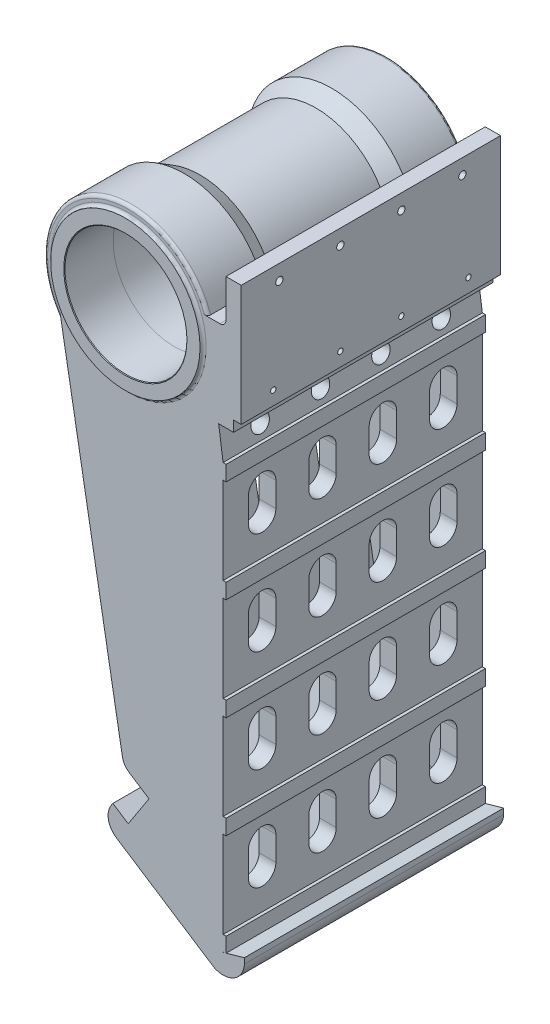
from build123d import *

# Parameters (mm, degrees)
SKETCH_1_R                      = 245
EXTRUDE_1_DEPTH                 = 190
SKETCH_2_R                      = 245
EXTRUDE_2_DEPTH                 = 52
EXTRUDE_2_DRAFT                 = -30
SKETCH_3_R                      = 275.022213998
EXTRUDE_3_DEPTH                 = 183
EXTRUDE_START                   = 10
SKETCH_4_R                      = 245
EXTRUDE_4_DEPTH                 = 10
FILLET_1_R                      = 10
FILLET_2_R                      = 10
SKETCH_5_R                      = 200
CUT_EXTRUDE_1_DEPTH             = 160
CHAMFER_1_SIZE                  = 2
MIRROR_3_COPY_1_SKETCH_R        = 245
MIRROR_3_COPY_1_DEPTH           = 52
MIRROR_3_COPY_1_DRAFT           = -30
FILLET_1_OF_MIRROR_3_R          = 10
FILLET_2_OF_MIRROR_3_R          = 10
CHAMFER_1_OF_MIRROR_3_SIZE      = 2
SKETCH_6_R                      = 200.25
CUT_EXTRUDE_2_DEPTH             = 550
EXTRUDE_5_DEPTH                 = 425
EXTRUDE_6_DEPTH                 = 425
EXTRUDE_8_DEPTH                 = 49
SKETCH_14_W                     = 10
SKETCH_14_H                     = 50
EXTRUDE_9_DEPTH                 = 425
PATTERN_LINEAR_1_COUNT          = 5
PATTERN_LINEAR_1_PITCH          = 335
FILLET_4_R                      = 20
FILLET_5_R                      = 50
FILLET_6_R                      = 60
SKETCH_15_R                     = 12
CUT_EXTRUDE_5_DEPTH             = 50
SKETCH_16_R                     = 17.5
CUT_EXTRUDE_6_DEPTH             = 5
PATTERN_LINEAR_3_COUNT          = 3
PATTERN_LINEAR_3_PITCH          = 200
PATTERN_LINEAR_3_COUNT_DIR2     = 3
PATTERN_LINEAR_3_PITCH_DIR2     = 200
CUT_EXTRUDE_7_REACH             = 1922.39
SKETCH_17_R                     = 30
PATTERN_LINEAR_7_COUNT          = 2
PATTERN_LINEAR_7_PITCH          = 198
PATTERN_LINEAR_7_COL_COUNT      = 3
PATTERN_LINEAR_7_COL_PITCH      = 198
PATTERN_LINEAR_8_COUNT          = 2
PATTERN_LINEAR_8_PITCH          = 200
PATTERN_LINEAR_8_COL_COUNT      = 2
PATTERN_LINEAR_8_COL_PITCH      = 220
CUT_EXTRUDE_8_DEPTH             = 55
PATTERN_LINEAR_9_COUNT          = 3
PATTERN_LINEAR_9_PITCH          = 198
PATTERN_LINEAR_9_COUNT_DIR2     = 3
PATTERN_LINEAR_9_PITCH_DIR2     = 198
PATTERN_LINEAR_10_COUNT         = 4
PATTERN_LINEAR_10_PITCH         = 335
PATTERN_LINEAR_10_COPY_1_DEPTH  = 55
PATTERN_LINEAR_10_COPY_2_DEPTH  = 55
PATTERN_LINEAR_10_COPY_3_DEPTH  = 55
PATTERN_LINEAR_10_COPY_4_DEPTH  = 55
PATTERN_LINEAR_10_COPY_5_DEPTH  = 55
PATTERN_LINEAR_10_COPY_6_DEPTH  = 55
PATTERN_LINEAR_10_COPY_7_DEPTH  = 55
PATTERN_LINEAR_10_COPY_8_DEPTH  = 55
PATTERN_LINEAR_10_COPY_9_DEPTH  = 55
PATTERN_LINEAR_10_COPY_10_DEPTH = 55
PATTERN_LINEAR_10_COPY_11_DEPTH = 55
PATTERN_LINEAR_10_COPY_12_DEPTH = 55
PATTERN_LINEAR_10_COPY_13_DEPTH = 55
PATTERN_LINEAR_10_COPY_14_DEPTH = 55
PATTERN_LINEAR_10_COPY_15_DEPTH = 55
PATTERN_LINEAR_10_COPY_16_DEPTH = 55
PATTERN_LINEAR_10_COPY_17_DEPTH = 55
PATTERN_LINEAR_10_COPY_18_DEPTH = 55
PATTERN_LINEAR_10_COPY_19_DEPTH = 55
PATTERN_LINEAR_10_COPY_20_DEPTH = 55
PATTERN_LINEAR_10_COPY_21_DEPTH = 55
PATTERN_LINEAR_10_COPY_22_DEPTH = 55
PATTERN_LINEAR_10_COPY_23_DEPTH = 55
PATTERN_LINEAR_10_COPY_24_DEPTH = 55
CUT_EXTRUDE_9_DEPTH             = 50
PATTERN_LINEAR_12_COUNT         = 3
PATTERN_LINEAR_12_PITCH         = 198
PATTERN_LINEAR_12_COL_COUNT     = 2
PATTERN_LINEAR_12_COL_PITCH     = 198
EXTRUDE_11_DEPTH                = 25
SKETCH_44_R                     = 18
CUT_EXTRUDE_13_DEPTH            = 200


with BuildPart() as part:
    # 草图1 → 凸台-拉伸1 (new, symmetric)
    with BuildSketch(Plane.XY):
        Circle(SKETCH_1_R)
    extrude(amount=EXTRUDE_1_DEPTH, both=True)


with BuildPart() as extrude_2_tool:
    # 草图2 → 凸台-拉伸2 (with draft: the straight prism first)
    with BuildSketch(Plane.XY.offset(190)):
        Circle(SKETCH_2_R)
    extrude(amount=EXTRUDE_2_DEPTH)
    # 凸台-拉伸2: the draft: its side faces are tilted about the plane it starts from
    extrude_2_sides = [extrude_2_tool.faces().sort_by_distance(p)[0] for p in [
        (-245, 0, 216),
    ]]
    draft(extrude_2_sides, Plane.XY.offset(190), EXTRUDE_2_DRAFT)


with BuildPart() as part_1:
    add(part.part)

    # 凸台-拉伸2: add extrude_2_tool
    add(extrude_2_tool.part)

    # 草图3 → 凸台-拉伸3 (add)
    with BuildSketch(Plane.XY.offset(242)):
        Circle(SKETCH_3_R)
    extrude_3 = extrude(amount=EXTRUDE_3_DEPTH)

    # 草图4 → 凸台-拉伸4 (add)
    with BuildSketch(Plane.XY.offset(425).offset(EXTRUDE_START)):
        Circle(SKETCH_4_R)
    extrude_4 = extrude(amount=-EXTRUDE_4_DEPTH)

    # 圆角1
    fillet_1_edges = [part_1.edges().sort_by_distance(p)[0] for p in [
        (-245, 0, 425),
    ]]
    fillet(fillet_1_edges, radius=FILLET_1_R - 0.0001)  # a hair under: the kernel refuses the full size

    # 圆角2
    fillet_2_edges = [part_1.edges().sort_by_distance(p)[0] for p in [
        (-275.022213998, 0, 425),
    ]]
    fillet(fillet_2_edges, radius=FILLET_2_R)

    # 草图5 → 切除-拉伸1 (cut)
    with BuildSketch(Plane.XY.offset(435)):
        Circle(SKETCH_5_R)
    cut_extrude_1 = extrude(amount=-CUT_EXTRUDE_1_DEPTH, mode=Mode.SUBTRACT)

    # 倒角1
    chamfer_1_edges = [part_1.edges().sort_by_distance(p)[0] for p in [
        (-200, 0, 435),
    ]]
    chamfer(chamfer_1_edges, length=CHAMFER_1_SIZE)


with BuildPart() as mirror_3_1:
    # 镜向3: 凸台-拉伸3, 凸台-拉伸4, 切除-拉伸1 across plane
    add(extrude_3.mirror(Plane.XY))
    add(extrude_4.mirror(Plane.XY))
    add(cut_extrude_1.mirror(Plane.XY), mode=Mode.SUBTRACT)


with BuildPart() as mirror_3_copy_1_tool:
    # 镜向3 copy 1 sketch → 镜向3 copy 1 (with draft: the straight prism first)
    with BuildSketch(Plane(origin=(0, 0, -190), x_dir=(1, 0, 0), z_dir=(0, 0, -1))):
        Circle(MIRROR_3_COPY_1_SKETCH_R)
    extrude(amount=MIRROR_3_COPY_1_DEPTH)
    # 镜向3 copy 1: the draft: its side faces are tilted about the plane it starts from
    mirror_3_copy_1_sides = [mirror_3_copy_1_tool.faces().sort_by_distance(p)[0] for p in [
        (-245, 0, -216),
    ]]
    draft(mirror_3_copy_1_sides, Plane(origin=(0, 0, -190), x_dir=(1, 0, 0), z_dir=(0, 0, -1)), MIRROR_3_COPY_1_DRAFT)


with BuildPart() as part_2:
    add(part_1.part)

    # 镜向3 copy 1: add mirror_3_copy_1_tool
    add(mirror_3_copy_1_tool.part)

    add(mirror_3_1.part)  # 镜向3 copy 1 merges 镜向3_1

    # 圆角1 of 镜向3
    fillet_1_of_mirror_3_edges = [part_2.edges().sort_by_distance(p)[0] for p in [
        (-245, 0, -425),
    ]]
    fillet(fillet_1_of_mirror_3_edges, radius=FILLET_1_OF_MIRROR_3_R - 0.0001)  # a hair under: the kernel refuses the full size

    # 圆角2 of 镜向3
    fillet_2_of_mirror_3_edges = [part_2.edges().sort_by_distance(p)[0] for p in [
        (-275.022213998, 0, -425),
    ]]
    fillet(fillet_2_of_mirror_3_edges, radius=FILLET_2_OF_MIRROR_3_R)

    # 倒角1 of 镜向3
    chamfer_1_of_mirror_3_edges = [part_2.edges().sort_by_distance(p)[0] for p in [
        (-200, 0, -435),
    ]]
    chamfer(chamfer_1_of_mirror_3_edges, length=CHAMFER_1_OF_MIRROR_3_SIZE)

    # 草图6 → 切除-拉伸2 (cut)
    with BuildSketch(Plane.XY.offset(275)):
        Circle(SKETCH_6_R)
    extrude(amount=-CUT_EXTRUDE_2_DEPTH, mode=Mode.SUBTRACT)

    # 草图7 → 凸台-拉伸5 (add, symmetric)
    with BuildSketch(Plane.XY):
        with BuildLine():
            Line((227.870577302, 90), (320, 90))
            Line((320, 90), (320, 234))
            Line((320, 234), (370, 234))
            Line((370, 234), (370, -161))
            Line((370, -161), (345, -161))
            Line((345, -161), (345, -196))
            Line((345, -196), (296, -196))
            Line((296, -196), (310.475705974, -299))
            Line((310.475705974, -299), (310.475705974, -1690))
            Line((310.475705974, -1690), (380.475705974, -1669.927822997))
            Line((380.475705974, -1669.927822997), (380.475705974, -1688.027822997))
            ThreePointArc((380.475705974, -1688.027822997), (347.162577196, -1744.026857278), (282.145430035, -1748.319521313))
            Line((282.145430035, -1748.319521313), (255.475705974, -1731))
            Line((255.475705974, -1731), (255.475705974, -302.554409963))
            Line((255.475705974, -302.554409963), (245.719671597, -233.136618344))
            ThreePointArc((245.719671597, -233.136618344), (208.94996523, -185.924952833), (149.653701412, -193.981364191))
            ThreePointArc((149.653701412, -193.981364191), (236.204358674, -65.057673977), (227.870577302, 90))
        make_face()
    extrude(amount=EXTRUDE_5_DEPTH, both=True)

    # 草图8 → 凸台-拉伸6 (add, symmetric)
    with BuildSketch(Plane.XY):
        with BuildLine():
            Line((255.475705974, -1731), (255.475705974, -1665.420018894))
            Line((255.475705974, -1665.420018894), (41.074222564, -1526.186067575))
            Line((41.074222564, -1526.186067575), (150.485500365, -1357.707474244))
            Line((150.485500365, -1357.707474244), (27.284793933, -1277.7))
            Line((27.284793933, -1277.7), (-153.834912751, -250.519100308))
            ThreePointArc((-153.834912751, -250.519100308), (-142.162732197, -221.214224788), (-110.73169687, -218.548601707))
            ThreePointArc((-110.73169687, -218.548601707), (-196.779346547, -145.955091629), (-241.277899488, -42.543803528))
            Line((-241.277899488, -42.543803528), (-15.806035671, -1321.258285628))
            Line((-15.806035671, -1321.258285628), (67.486924187, -1375.34936622))
            Line((67.486924187, -1375.34936622), (-0.59295519, -1480.183187213))
            Line((-0.59295519, -1480.183187213), (-50.913189267, -1447.504845112))
            Line((-50.913189267, -1447.504845112), (-89.521392515, -1506.95626461))
            Line((-89.521392515, -1506.95626461), (255.475705974, -1731))
        make_face()
    extrude(amount=EXTRUDE_6_DEPTH, both=True)

    # 草图10 → 凸台-拉伸8 (add)
    with BuildSketch(Plane.XY.offset(425)):
        with BuildLine():
            Line((380.475705974, -1669.927822997), (310.475705974, -1690))
            Line((310.475705974, -1690), (310.475705974, -299))
            Line((310.475705974, -299), (296, -196))
            Line((296, -196), (345, -196))
            Line((345, -196), (345, -161))
            Line((345, -161), (240.158662049, -112.07404229))
            ThreePointArc((240.158662049, -112.07404229), (17.096540138, -264.470191567), (-223.730174254, -142.061898624))
            Line((-223.730174254, -142.061898624), (-15.806035671, -1321.258285628))
            Line((-15.806035671, -1321.258285628), (67.486924187, -1375.34936622))
            Line((67.486924187, -1375.34936622), (-0.59295519, -1480.183187213))
            Line((-0.59295519, -1480.183187213), (-50.913189267, -1447.504845112))
            Line((-50.913189267, -1447.504845112), (-89.521392515, -1506.95626461))
            Line((-89.521392515, -1506.95626461), (282.145430035, -1748.319521313))
            ThreePointArc((282.145430035, -1748.319521313), (347.162577196, -1744.026857278), (380.475705974, -1688.027822997))
            Line((380.475705974, -1688.027822997), (380.475705974, -1669.927822997))
        make_face()
    extrude_8 = extrude(amount=-EXTRUDE_8_DEPTH)

    # 镜向4: 凸台-拉伸8 across plane
    add(extrude_8.mirror(Plane.XY))

    # 草图14 → 凸台-拉伸9 (add, symmetric)
    with BuildSketch(Plane.XY):
        with Locations((315.475705974, -324)):
            Rectangle(SKETCH_14_W, SKETCH_14_H)
    extrude_9 = extrude(amount=EXTRUDE_9_DEPTH, both=True)

    # 阵列(线性)1: 凸台-拉伸9 ×5
    with Locations(*[(0, -i * PATTERN_LINEAR_1_PITCH, 0) for i in range(1, PATTERN_LINEAR_1_COUNT)]):
        add(extrude_9)

    # 圆角4
    fillet_4_edges = [part_2.edges().sort_by_distance(p)[0] for p in [
        (320, 90, 0),
    ]]
    fillet(fillet_4_edges, radius=FILLET_4_R)

    # 圆角5
    fillet_5_edges = [part_2.edges().sort_by_distance(p)[0] for p in [
        (-15.806035671, -1321.258285628, 0),
    ]]
    fillet(fillet_5_edges, radius=FILLET_5_R)

    # 圆角6
    fillet_6_edges = [part_2.edges().sort_by_distance(p)[0] for p in [
        (-89.521392515, -1506.95626461, 0),
    ]]
    fillet(fillet_6_edges, radius=FILLET_6_R)

    # 草图15 → 切除-拉伸5 (cut)
    with BuildSketch(Plane(origin=(370, 0, 0), x_dir=(0, 0, -1), z_dir=(1, 0, 0))):
        with Locations((-100, 184)):
            Circle(SKETCH_15_R)
    cut_extrude_5 = extrude(amount=-CUT_EXTRUDE_5_DEPTH, mode=Mode.SUBTRACT)

    # 草图16 → 切除-拉伸6 (cut)
    with BuildSketch(Plane.ZY.offset(-320)):
        with Locations((100, 184)):
            Circle(SKETCH_16_R)
    cut_extrude_6 = extrude(amount=-CUT_EXTRUDE_6_DEPTH, mode=Mode.SUBTRACT)

    # 阵列(线性)3: 切除-拉伸5, Cut-Extrude 6 3 × 3
    with Locations(*[Vector(0, 0, -1) * (i * PATTERN_LINEAR_3_PITCH) + Vector(0, 0, 1) * (j * PATTERN_LINEAR_3_PITCH_DIR2) for i in range(PATTERN_LINEAR_3_COUNT) for j in range(PATTERN_LINEAR_3_COUNT_DIR2) if (i, j) != (0, 0)]):
        add(cut_extrude_5, mode=Mode.SUBTRACT)
        add(cut_extrude_6, mode=Mode.SUBTRACT)

    # 草图17 → 切除-拉伸7 (cut, up to next)
    with BuildSketch(Plane(origin=(263.254270129, 36.997974863, 0), x_dir=(0, 0, -1), z_dir=(0.9902680687415698, 0.1391731009600692, 0)), mode=Mode.PRIVATE) as cut_extrude_7_sk1:
        with Locations(Location((-99, -292.107261305, 0), (0, 0, 90))):
            Circle(SKETCH_17_R)
    cut_extrude_7_tool1 = extrude(cut_extrude_7_sk1.sketch, amount=-CUT_EXTRUDE_7_REACH, mode=Mode.PRIVATE) & part_2.part
    cut_extrude_7 = cut_extrude_7_tool1.solids().sort_by_distance((303.907743, -252.266519, 99))[0]
    add(cut_extrude_7, mode=Mode.SUBTRACT)

    # 阵列(线性)7: 切除-拉伸7 ×2
    with Locations(*[(0, 0, i * PATTERN_LINEAR_7_PITCH) for i in range(1, PATTERN_LINEAR_7_COUNT)]):
        add(cut_extrude_7, mode=Mode.SUBTRACT)

    # 阵列(线性)7 col: 切除-拉伸7 ×3
    with Locations(*[(0, 0, -i * PATTERN_LINEAR_7_COL_PITCH) for i in range(1, PATTERN_LINEAR_7_COL_COUNT)]):
        add(cut_extrude_7, mode=Mode.SUBTRACT)

    # 草图19 → M20 螺纹孔1 (revolve, cut)
    with BuildSketch(Plane(origin=(370, -116, 100), x_dir=(0, 0, -1), z_dir=(0, 1, 0))):
        Polygon((0, 0), (0, 45.257530416), (8.75, 40), (8.75, 0), align=None)
    hole_wizard_m20_1 = revolve(axis=Axis((376.35, -116, 100), (-1, 0, 0)), mode=Mode.SUBTRACT)

    # 阵列(线性)8: M20 螺纹孔1 ×2
    with Locations(*[(0, 0, -i * PATTERN_LINEAR_8_PITCH) for i in range(1, PATTERN_LINEAR_8_COUNT)]):
        add(hole_wizard_m20_1, mode=Mode.SUBTRACT)

    # 阵列(线性)8 col: M20 螺纹孔1 ×2
    with Locations(*[(0, 0, i * PATTERN_LINEAR_8_COL_PITCH) for i in range(1, PATTERN_LINEAR_8_COL_COUNT)]):
        add(hole_wizard_m20_1, mode=Mode.SUBTRACT)

    # 草图20 → 切除-拉伸8 (cut)
    with BuildSketch(Plane(origin=(310.475705974, 0, 0), x_dir=(0, 0, -1), z_dir=(1, 0, 0))):
        with BuildLine():
            Line((-144, -516), (-144, -436))
            ThreePointArc((-144, -436), (-99, -391), (-54, -436))
            Line((-54, -436), (-54, -516))
            ThreePointArc((-54, -516), (-99, -561), (-144, -516))
        make_face()
    cut_extrude_8 = extrude(amount=-CUT_EXTRUDE_8_DEPTH, mode=Mode.SUBTRACT)

    # 阵列(线性)9: Cut-Extrude 8 3 × 3
    with Locations(*[Vector(0, 0, 1) * (i * PATTERN_LINEAR_9_PITCH) + Vector(0, 0, -1) * (j * PATTERN_LINEAR_9_PITCH_DIR2) for i in range(PATTERN_LINEAR_9_COUNT) for j in range(PATTERN_LINEAR_9_COUNT_DIR2) if (i, j) != (0, 0)]):
        add(cut_extrude_8, mode=Mode.SUBTRACT)

    # 阵列(线性)10: 切除-拉伸8 ×4
    with Locations(*[(0, -i * PATTERN_LINEAR_10_PITCH, 0) for i in range(1, PATTERN_LINEAR_10_COUNT)]):
        add(cut_extrude_8, mode=Mode.SUBTRACT)

    # 阵列(线性)10 copy 1 sketch → 阵列(线性)10 copy 1 (cut)
    with BuildSketch(Plane(origin=(310.475705974, -335, -198), x_dir=(0, 0, -1), z_dir=(1, 0, 0))):
        with BuildLine():
            Line((-144, -516), (-144, -436))
            ThreePointArc((-144, -436), (-99, -391), (-54, -436))
            Line((-54, -436), (-54, -516))
            ThreePointArc((-54, -516), (-99, -561), (-144, -516))
        make_face()
    extrude(amount=-PATTERN_LINEAR_10_COPY_1_DEPTH, mode=Mode.SUBTRACT)

    # 阵列(线性)10 copy 2 sketch → 阵列(线性)10 copy 2 (cut)
    with BuildSketch(Plane(origin=(310.475705974, -670, -198), x_dir=(0, 0, -1), z_dir=(1, 0, 0))):
        with BuildLine():
            Line((-144, -516), (-144, -436))
            ThreePointArc((-144, -436), (-99, -391), (-54, -436))
            Line((-54, -436), (-54, -516))
            ThreePointArc((-54, -516), (-99, -561), (-144, -516))
        make_face()
    extrude(amount=-PATTERN_LINEAR_10_COPY_2_DEPTH, mode=Mode.SUBTRACT)

    # 阵列(线性)10 copy 3 sketch → 阵列(线性)10 copy 3 (cut)
    with BuildSketch(Plane(origin=(310.475705974, -1005, -198), x_dir=(0, 0, -1), z_dir=(1, 0, 0))):
        with BuildLine():
            Line((-144, -516), (-144, -436))
            ThreePointArc((-144, -436), (-99, -391), (-54, -436))
            Line((-54, -436), (-54, -516))
            ThreePointArc((-54, -516), (-99, -561), (-144, -516))
        make_face()
    extrude(amount=-PATTERN_LINEAR_10_COPY_3_DEPTH, mode=Mode.SUBTRACT)

    # 阵列(线性)10 copy 4 sketch → 阵列(线性)10 copy 4 (cut)
    with BuildSketch(Plane(origin=(310.475705974, -335, -396), x_dir=(0, 0, -1), z_dir=(1, 0, 0))):
        with BuildLine():
            Line((-144, -516), (-144, -436))
            ThreePointArc((-144, -436), (-99, -391), (-54, -436))
            Line((-54, -436), (-54, -516))
            ThreePointArc((-54, -516), (-99, -561), (-144, -516))
        make_face()
    extrude(amount=-PATTERN_LINEAR_10_COPY_4_DEPTH, mode=Mode.SUBTRACT)

    # 阵列(线性)10 copy 5 sketch → 阵列(线性)10 copy 5 (cut)
    with BuildSketch(Plane(origin=(310.475705974, -670, -396), x_dir=(0, 0, -1), z_dir=(1, 0, 0))):
        with BuildLine():
            Line((-144, -516), (-144, -436))
            ThreePointArc((-144, -436), (-99, -391), (-54, -436))
            Line((-54, -436), (-54, -516))
            ThreePointArc((-54, -516), (-99, -561), (-144, -516))
        make_face()
    extrude(amount=-PATTERN_LINEAR_10_COPY_5_DEPTH, mode=Mode.SUBTRACT)

    # 阵列(线性)10 copy 6 sketch → 阵列(线性)10 copy 6 (cut)
    with BuildSketch(Plane(origin=(310.475705974, -1005, -396), x_dir=(0, 0, -1), z_dir=(1, 0, 0))):
        with BuildLine():
            Line((-144, -516), (-144, -436))
            ThreePointArc((-144, -436), (-99, -391), (-54, -436))
            Line((-54, -436), (-54, -516))
            ThreePointArc((-54, -516), (-99, -561), (-144, -516))
        make_face()
    extrude(amount=-PATTERN_LINEAR_10_COPY_6_DEPTH, mode=Mode.SUBTRACT)

    # 阵列(线性)10 copy 7 sketch → 阵列(线性)10 copy 7 (cut)
    with BuildSketch(Plane(origin=(310.475705974, -335, 198), x_dir=(0, 0, -1), z_dir=(1, 0, 0))):
        with BuildLine():
            Line((-144, -516), (-144, -436))
            ThreePointArc((-144, -436), (-99, -391), (-54, -436))
            Line((-54, -436), (-54, -516))
            ThreePointArc((-54, -516), (-99, -561), (-144, -516))
        make_face()
    extrude(amount=-PATTERN_LINEAR_10_COPY_7_DEPTH, mode=Mode.SUBTRACT)

    # 阵列(线性)10 copy 8 sketch → 阵列(线性)10 copy 8 (cut)
    with BuildSketch(Plane(origin=(310.475705974, -670, 198), x_dir=(0, 0, -1), z_dir=(1, 0, 0))):
        with BuildLine():
            Line((-144, -516), (-144, -436))
            ThreePointArc((-144, -436), (-99, -391), (-54, -436))
            Line((-54, -436), (-54, -516))
            ThreePointArc((-54, -516), (-99, -561), (-144, -516))
        make_face()
    extrude(amount=-PATTERN_LINEAR_10_COPY_8_DEPTH, mode=Mode.SUBTRACT)

    # 阵列(线性)10 copy 9 sketch → 阵列(线性)10 copy 9 (cut)
    with BuildSketch(Plane(origin=(310.475705974, -1005, 198), x_dir=(0, 0, -1), z_dir=(1, 0, 0))):
        with BuildLine():
            Line((-144, -516), (-144, -436))
            ThreePointArc((-144, -436), (-99, -391), (-54, -436))
            Line((-54, -436), (-54, -516))
            ThreePointArc((-54, -516), (-99, -561), (-144, -516))
        make_face()
    extrude(amount=-PATTERN_LINEAR_10_COPY_9_DEPTH, mode=Mode.SUBTRACT)

    # 阵列(线性)10 copy 10 sketch → 阵列(线性)10 copy 10 (cut)
    with BuildSketch(Plane(origin=(310.475705974, -335, 0), x_dir=(0, 0, -1), z_dir=(1, 0, 0))):
        with BuildLine():
            Line((-144, -516), (-144, -436))
            ThreePointArc((-144, -436), (-99, -391), (-54, -436))
            Line((-54, -436), (-54, -516))
            ThreePointArc((-54, -516), (-99, -561), (-144, -516))
        make_face()
    extrude(amount=-PATTERN_LINEAR_10_COPY_10_DEPTH, mode=Mode.SUBTRACT)

    # 阵列(线性)10 copy 11 sketch → 阵列(线性)10 copy 11 (cut)
    with BuildSketch(Plane(origin=(310.475705974, -670, 0), x_dir=(0, 0, -1), z_dir=(1, 0, 0))):
        with BuildLine():
            Line((-144, -516), (-144, -436))
            ThreePointArc((-144, -436), (-99, -391), (-54, -436))
            Line((-54, -436), (-54, -516))
            ThreePointArc((-54, -516), (-99, -561), (-144, -516))
        make_face()
    extrude(amount=-PATTERN_LINEAR_10_COPY_11_DEPTH, mode=Mode.SUBTRACT)

    # 阵列(线性)10 copy 12 sketch → 阵列(线性)10 copy 12 (cut)
    with BuildSketch(Plane(origin=(310.475705974, -1005, 0), x_dir=(0, 0, -1), z_dir=(1, 0, 0))):
        with BuildLine():
            Line((-144, -516), (-144, -436))
            ThreePointArc((-144, -436), (-99, -391), (-54, -436))
            Line((-54, -436), (-54, -516))
            ThreePointArc((-54, -516), (-99, -561), (-144, -516))
        make_face()
    extrude(amount=-PATTERN_LINEAR_10_COPY_12_DEPTH, mode=Mode.SUBTRACT)

    # 阵列(线性)10 copy 13 sketch → 阵列(线性)10 copy 13 (cut)
    with BuildSketch(Plane(origin=(310.475705974, -335, -198), x_dir=(0, 0, -1), z_dir=(1, 0, 0))):
        with BuildLine():
            Line((-144, -516), (-144, -436))
            ThreePointArc((-144, -436), (-99, -391), (-54, -436))
            Line((-54, -436), (-54, -516))
            ThreePointArc((-54, -516), (-99, -561), (-144, -516))
        make_face()
    extrude(amount=-PATTERN_LINEAR_10_COPY_13_DEPTH, mode=Mode.SUBTRACT)

    # 阵列(线性)10 copy 14 sketch → 阵列(线性)10 copy 14 (cut)
    with BuildSketch(Plane(origin=(310.475705974, -670, -198), x_dir=(0, 0, -1), z_dir=(1, 0, 0))):
        with BuildLine():
            Line((-144, -516), (-144, -436))
            ThreePointArc((-144, -436), (-99, -391), (-54, -436))
            Line((-54, -436), (-54, -516))
            ThreePointArc((-54, -516), (-99, -561), (-144, -516))
        make_face()
    extrude(amount=-PATTERN_LINEAR_10_COPY_14_DEPTH, mode=Mode.SUBTRACT)

    # 阵列(线性)10 copy 15 sketch → 阵列(线性)10 copy 15 (cut)
    with BuildSketch(Plane(origin=(310.475705974, -1005, -198), x_dir=(0, 0, -1), z_dir=(1, 0, 0))):
        with BuildLine():
            Line((-144, -516), (-144, -436))
            ThreePointArc((-144, -436), (-99, -391), (-54, -436))
            Line((-54, -436), (-54, -516))
            ThreePointArc((-54, -516), (-99, -561), (-144, -516))
        make_face()
    extrude(amount=-PATTERN_LINEAR_10_COPY_15_DEPTH, mode=Mode.SUBTRACT)

    # 阵列(线性)10 copy 16 sketch → 阵列(线性)10 copy 16 (cut)
    with BuildSketch(Plane(origin=(310.475705974, -335, 396), x_dir=(0, 0, -1), z_dir=(1, 0, 0))):
        with BuildLine():
            Line((-144, -516), (-144, -436))
            ThreePointArc((-144, -436), (-99, -391), (-54, -436))
            Line((-54, -436), (-54, -516))
            ThreePointArc((-54, -516), (-99, -561), (-144, -516))
        make_face()
    extrude(amount=-PATTERN_LINEAR_10_COPY_16_DEPTH, mode=Mode.SUBTRACT)

    # 阵列(线性)10 copy 17 sketch → 阵列(线性)10 copy 17 (cut)
    with BuildSketch(Plane(origin=(310.475705974, -670, 396), x_dir=(0, 0, -1), z_dir=(1, 0, 0))):
        with BuildLine():
            Line((-144, -516), (-144, -436))
            ThreePointArc((-144, -436), (-99, -391), (-54, -436))
            Line((-54, -436), (-54, -516))
            ThreePointArc((-54, -516), (-99, -561), (-144, -516))
        make_face()
    extrude(amount=-PATTERN_LINEAR_10_COPY_17_DEPTH, mode=Mode.SUBTRACT)

    # 阵列(线性)10 copy 18 sketch → 阵列(线性)10 copy 18 (cut)
    with BuildSketch(Plane(origin=(310.475705974, -1005, 396), x_dir=(0, 0, -1), z_dir=(1, 0, 0))):
        with BuildLine():
            Line((-144, -516), (-144, -436))
            ThreePointArc((-144, -436), (-99, -391), (-54, -436))
            Line((-54, -436), (-54, -516))
            ThreePointArc((-54, -516), (-99, -561), (-144, -516))
        make_face()
    extrude(amount=-PATTERN_LINEAR_10_COPY_18_DEPTH, mode=Mode.SUBTRACT)

    # 阵列(线性)10 copy 19 sketch → 阵列(线性)10 copy 19 (cut)
    with BuildSketch(Plane(origin=(310.475705974, -335, 198), x_dir=(0, 0, -1), z_dir=(1, 0, 0))):
        with BuildLine():
            Line((-144, -516), (-144, -436))
            ThreePointArc((-144, -436), (-99, -391), (-54, -436))
            Line((-54, -436), (-54, -516))
            ThreePointArc((-54, -516), (-99, -561), (-144, -516))
        make_face()
    extrude(amount=-PATTERN_LINEAR_10_COPY_19_DEPTH, mode=Mode.SUBTRACT)

    # 阵列(线性)10 copy 20 sketch → 阵列(线性)10 copy 20 (cut)
    with BuildSketch(Plane(origin=(310.475705974, -670, 198), x_dir=(0, 0, -1), z_dir=(1, 0, 0))):
        with BuildLine():
            Line((-144, -516), (-144, -436))
            ThreePointArc((-144, -436), (-99, -391), (-54, -436))
            Line((-54, -436), (-54, -516))
            ThreePointArc((-54, -516), (-99, -561), (-144, -516))
        make_face()
    extrude(amount=-PATTERN_LINEAR_10_COPY_20_DEPTH, mode=Mode.SUBTRACT)

    # 阵列(线性)10 copy 21 sketch → 阵列(线性)10 copy 21 (cut)
    with BuildSketch(Plane(origin=(310.475705974, -1005, 198), x_dir=(0, 0, -1), z_dir=(1, 0, 0))):
        with BuildLine():
            Line((-144, -516), (-144, -436))
            ThreePointArc((-144, -436), (-99, -391), (-54, -436))
            Line((-54, -436), (-54, -516))
            ThreePointArc((-54, -516), (-99, -561), (-144, -516))
        make_face()
    extrude(amount=-PATTERN_LINEAR_10_COPY_21_DEPTH, mode=Mode.SUBTRACT)

    # 阵列(线性)10 copy 22 sketch → 阵列(线性)10 copy 22 (cut)
    with BuildSketch(Plane(origin=(310.475705974, -335, 0), x_dir=(0, 0, -1), z_dir=(1, 0, 0))):
        with BuildLine():
            Line((-144, -516), (-144, -436))
            ThreePointArc((-144, -436), (-99, -391), (-54, -436))
            Line((-54, -436), (-54, -516))
            ThreePointArc((-54, -516), (-99, -561), (-144, -516))
        make_face()
    extrude(amount=-PATTERN_LINEAR_10_COPY_22_DEPTH, mode=Mode.SUBTRACT)

    # 阵列(线性)10 copy 23 sketch → 阵列(线性)10 copy 23 (cut)
    with BuildSketch(Plane(origin=(310.475705974, -670, 0), x_dir=(0, 0, -1), z_dir=(1, 0, 0))):
        with BuildLine():
            Line((-144, -516), (-144, -436))
            ThreePointArc((-144, -436), (-99, -391), (-54, -436))
            Line((-54, -436), (-54, -516))
            ThreePointArc((-54, -516), (-99, -561), (-144, -516))
        make_face()
    extrude(amount=-PATTERN_LINEAR_10_COPY_23_DEPTH, mode=Mode.SUBTRACT)

    # 阵列(线性)10 copy 24 sketch → 阵列(线性)10 copy 24 (cut)
    with BuildSketch(Plane(origin=(310.475705974, -1005, 0), x_dir=(0, 0, -1), z_dir=(1, 0, 0))):
        with BuildLine():
            Line((-144, -516), (-144, -436))
            ThreePointArc((-144, -436), (-99, -391), (-54, -436))
            Line((-54, -436), (-54, -516))
            ThreePointArc((-54, -516), (-99, -561), (-144, -516))
        make_face()
    extrude(amount=-PATTERN_LINEAR_10_COPY_24_DEPTH, mode=Mode.SUBTRACT)

    # 草图24 → 切除-拉伸9 (cut)
    with BuildSketch(Plane(origin=(-241.277899488, -42.543803528, 0), x_dir=(0, 0, 1), z_dir=(-0.9848077530122078, -0.17364817766693216, 0))):
        with BuildLine():
            Line((54, -922), (54, -522))
            ThreePointArc((54, -522), (99, -477), (144, -522))
            Line((144, -522), (144, -922))
            ThreePointArc((144, -922), (99, -967), (54, -922))
        make_face()
    cut_extrude_9 = extrude(amount=-CUT_EXTRUDE_9_DEPTH, mode=Mode.SUBTRACT)

    # 阵列(线性)12: 切除-拉伸9 ×3
    with Locations(*[(0, 0, -i * PATTERN_LINEAR_12_PITCH) for i in range(1, PATTERN_LINEAR_12_COUNT)]):
        add(cut_extrude_9, mode=Mode.SUBTRACT)

    # 阵列(线性)12 col: 切除-拉伸9 ×2
    with Locations(*[(0, 0, i * PATTERN_LINEAR_12_COL_PITCH) for i in range(1, PATTERN_LINEAR_12_COL_COUNT)]):
        add(cut_extrude_9, mode=Mode.SUBTRACT)

    # 草图26 → Ø20.0 (20) 直径孔1 (revolve, cut)
    with BuildSketch(Plane(origin=(33.392520595, -1427.850143773, 200), x_dir=(-0.544639035015024, -0.838670567945426, 0), z_dir=(0, 0, 1))):
        Polygon((0, 0), (0, 31.00860619), (10, 25), (10, 0), align=None)
    hole_wizard_20_0_20_1 = revolve(axis=Axis((28.066962489, -1424.391685901, 200), (0.8386705679454262, -0.5446390350150239, 0)), mode=Mode.SUBTRACT)

    # 镜向5: Ø20.0 (20) 直径孔1 across plane
    add(hole_wizard_20_0_20_1.mirror(Plane.XY), mode=Mode.SUBTRACT)

    # 草图28 → 凸台-拉伸11 (add, symmetric)
    with BuildSketch(Plane.XY):
        with BuildLine():
            Line((116.918010334, -1641.019580355), (-39.201158438, -1539.634606711))
            Line((-39.201158438, -1539.634606711), (-18.586109021, -1597.3489128))
            ThreePointArc((-18.586109021, -1597.3489128), (-23.824625556, -1618.744371076), (-45.555390957, -1622.347359477))
            Line((-45.555390957, -1622.347359477), (18.392791078, -1650.818924493))
            Line((18.392791078, -1650.818924493), (82.340973113, -1679.290489508))
            ThreePointArc((82.340973113, -1679.290489508), (70.91275396, -1656.861346539), (90.475705974, -1641.019580355))
            Line((90.475705974, -1641.019580355), (116.918010334, -1641.019580355))
        make_face()
        Polygon((18.392791078, -1650.818924493), (-45.555390957, -1622.347359477), (-63.82630011, -1614.212626616), (-76.028399402, -1641.618990345), (6.190691786, -1678.225288222), align=None)
        Polygon((82.340973113, -1679.290489508), (18.392791078, -1650.818924493), (6.190691786, -1678.225288222), (88.409782973, -1714.831586099), (100.611882266, -1687.42522237), align=None)
    extrude(amount=EXTRUDE_11_DEPTH, both=True)

    # 镜向7 copy 1 sketch → 镜向7 copy 1 (revolve, cut)
    with BuildSketch(Plane(origin=(370, -116, 100), x_dir=(0, 0, 1), z_dir=(0, 1, 0))):
        Polygon((0, 0), (0, -45.257530416), (8.75, -40), (8.75, 0), align=None)
    revolve(axis=Axis((376.35, -116, 100), (1, 0, 0)), mode=Mode.SUBTRACT)

    # 镜向7 copy 2 sketch → 镜向7 copy 2 (revolve, cut)
    with BuildSketch(Plane(origin=(370, -116, -320), x_dir=(0, 0, 1), z_dir=(0, 1, 0))):
        Polygon((0, 0), (0, -45.257530416), (8.75, -40), (8.75, 0), align=None)
    revolve(axis=Axis((376.35, -116, -320), (1, 0, 0)), mode=Mode.SUBTRACT)

    # 镜向7 copy 3 sketch → 镜向7 copy 3 (revolve, cut)
    with BuildSketch(Plane(origin=(370, -116, -100), x_dir=(0, 0, 1), z_dir=(0, 1, 0))):
        Polygon((0, 0), (0, -45.257530416), (8.75, -40), (8.75, 0), align=None)
    revolve(axis=Axis((376.35, -116, -100), (1, 0, 0)), mode=Mode.SUBTRACT)

    # 草图44 → 切除-拉伸13 (cut)
    with BuildSketch(Plane(origin=(546.529664843, -243.33068416, 0), x_dir=(0, 0, 1), z_dir=(-0.913545457642602, 0.40673664307579793, 0))):
        with Locations(Location((0, -1482.66236485, 0), (0, 0, 265.936168232))):
            Circle(SKETCH_44_R)
    extrude(amount=-CUT_EXTRUDE_13_DEPTH, mode=Mode.SUBTRACT)


solid = part_2.part
